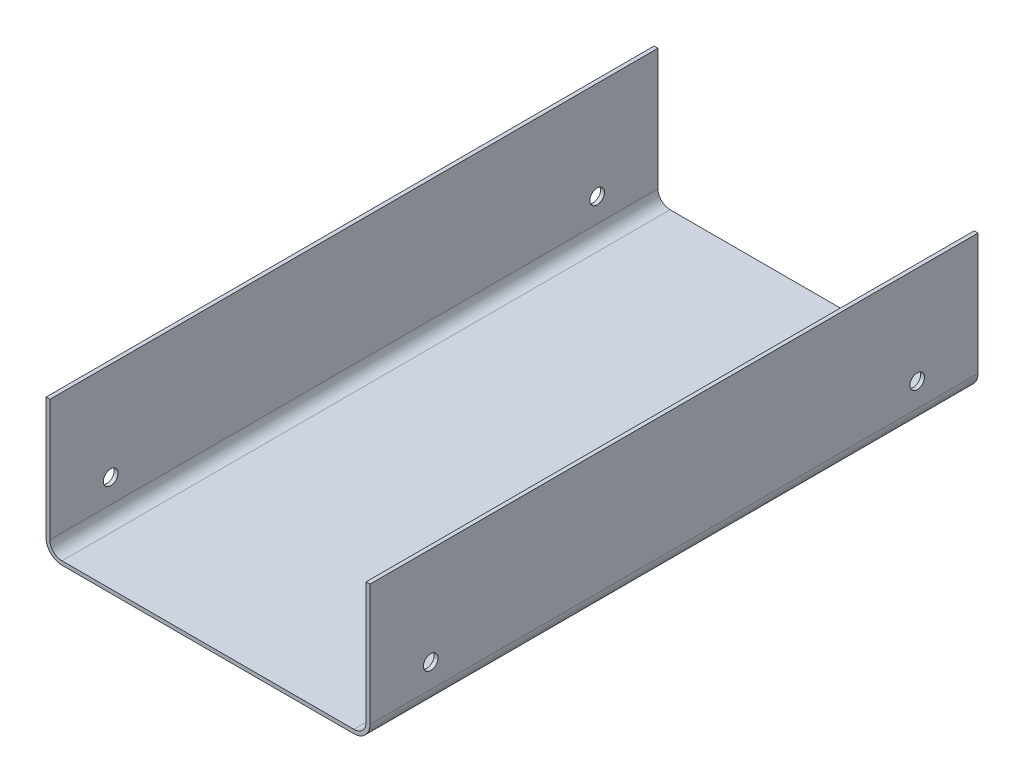
from build123d import *

# Parameters (mm, degrees)
BOSS_EXTRUDE1_DEPTH = 500
FILLET2_R           = 10
FILLET3_R           = 13.18
SKETCH2_R           = 6
CUT_EXTRUDE1_DEPTH  = 578.102806786


with BuildPart() as part:
    # Sketch1 → Boss-Extrude1 (new body)
    with BuildSketch(Plane.XY):
        Polygon((130, 110), (130, 0), (-130, 0), (-130, 110), (-133.18, 110), (-133.18, -3.18), (133.18, -3.18), (133.18, 110), align=None)
    extrude(amount=BOSS_EXTRUDE1_DEPTH)

    # Fillet2
    fillet2_edges = [part.edges().sort_by_distance(p)[0] for p in [
        (130, 0, 250),
        (-130, 0, 250),
    ]]
    fillet(fillet2_edges, radius=FILLET2_R)

    # Fillet3
    fillet3_edges = [part.edges().sort_by_distance(p)[0] for p in [
        (-133.18, -3.18, 250),
        (133.18, -3.18, 250),
    ]]
    fillet(fillet3_edges, radius=FILLET3_R)

    # Sketch2 → Cut-Extrude1 (cut, through all)
    with BuildSketch(Plane(origin=(133.18, 0, 0), x_dir=(0, 0, -1), z_dir=(1, 0, 0))):
        with Locations((-450, 29.5)):
            Circle(SKETCH2_R)
        with Locations((-50, 29.5)):
            Circle(SKETCH2_R)
    extrude(amount=-CUT_EXTRUDE1_DEPTH, mode=Mode.SUBTRACT)


solid = part.part
